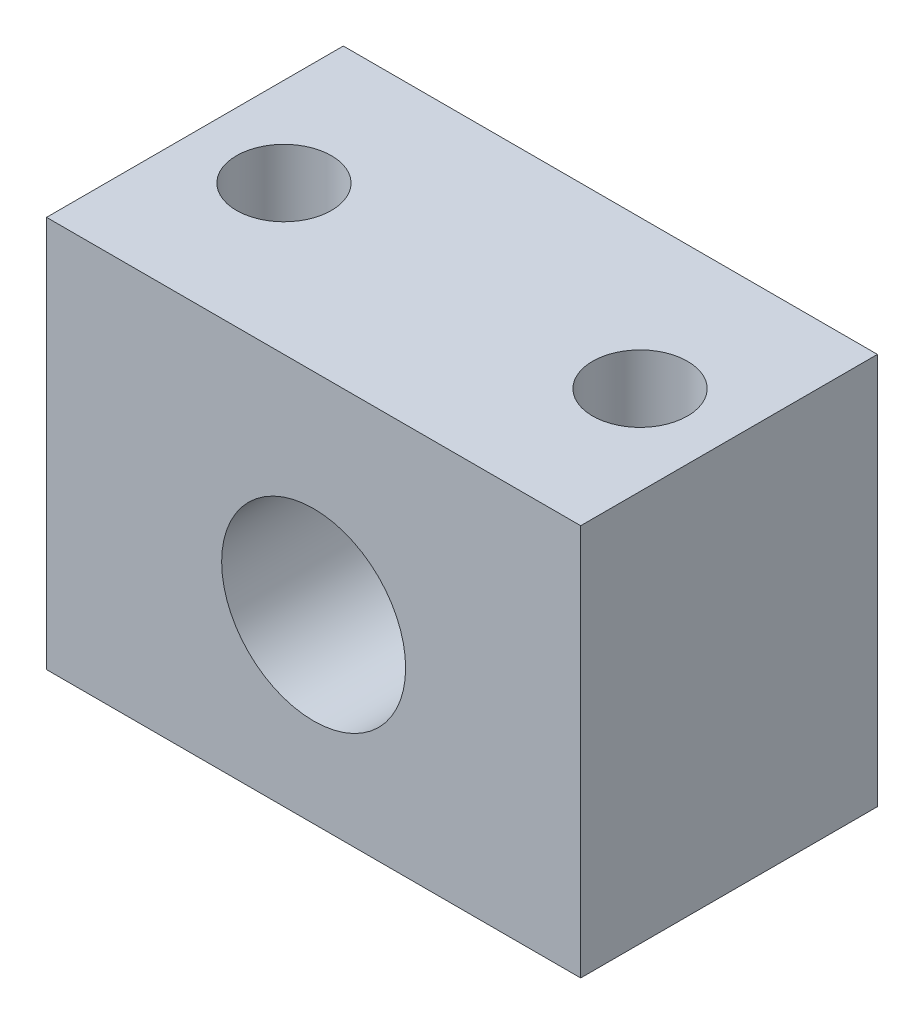
from build123d import *

# Parameters (mm, degrees)
SKETCH_1_W          = 18
SKETCH_1_H          = 13.2
SKETCH_1_R          = 3.1
EXTRUDE_1_DEPTH     = 10
SKETCH_2_R          = 1.6
CUT_EXTRUDE_1_DEPTH = 10


with BuildPart() as part:
    # ｽｹｯﾁ1 → ﾎﾞｽ - 押し出し1 (new body)
    with BuildSketch(Plane.XY):
        with Locations((0, 0.5)):
            Rectangle(SKETCH_1_W, SKETCH_1_H)
        Circle(SKETCH_1_R, mode=Mode.SUBTRACT)
    extrude(amount=EXTRUDE_1_DEPTH)

    # ｽｹｯﾁ2 → ｶｯﾄ - 押し出し1 (cut)
    with BuildSketch(Plane(origin=(0, 7.1, 0), x_dir=(1, 0, 0), z_dir=(0, 1, 0))):
        with Locations((-6, -5)):
            Circle(SKETCH_2_R)
        with Locations((6, -5)):
            Circle(SKETCH_2_R)
    extrude(amount=-CUT_EXTRUDE_1_DEPTH, mode=Mode.SUBTRACT)


solid = part.part
